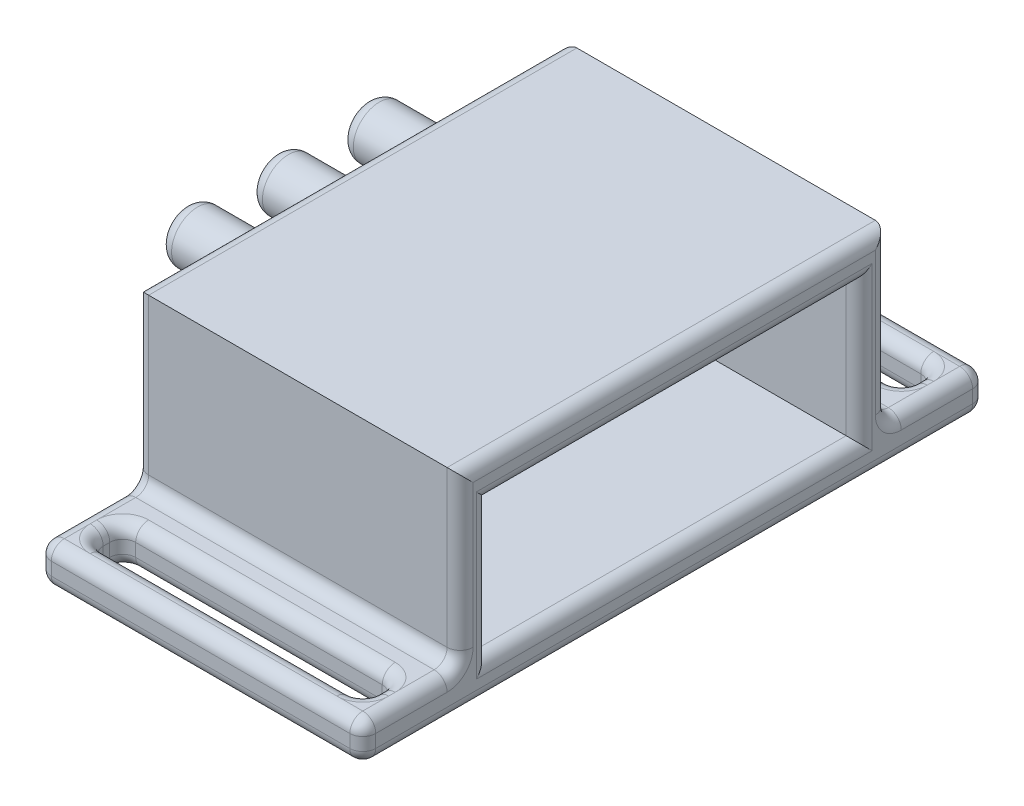
from build123d import *

# Parameters (mm, degrees)
BOSS_EXTRUDE1_DEPTH = 16
CUT_EXTRUDE1_DEPTH  = 12.5
SKETCH3_R           = 0.6000000000000006
SKETCH3_R_2         = 0.6000000000000004
CUT_EXTRUDE2_DEPTH  = 5.300000000000001
CUT_EXTRUDE3_DEPTH  = 13
FILLET1_R           = 1
SKETCH10_R          = 1.9999999999999996
SKETCH10_R_2        = 1.0000000000000033
SKETCH10_R_3        = 1.0000000000000018
SKETCH10_R_4        = 0.9999999999999979
BOSS_EXTRUDE2_DEPTH = 10
FILLET2_R           = 1
SKETCH11_W          = 21.000000000000004
SKETCH11_H          = 2.5
CUT_EXTRUDE5_DEPTH  = 56.65968020030299
FILLET3_R           = 1


with BuildPart() as part:
    # Sketch1 → Boss-Extrude1 (new body)
    with BuildSketch(Plane(origin=(0, 0, 0), x_dir=(1, 0, 0), z_dir=(0, 1, 0))):
        Polygon((0, 0), (25, 0), (25.000000000000007, -48), (5.88e-15, -48), align=None)
    extrude(amount=BOSS_EXTRUDE1_DEPTH)

    # Sketch2 → Cut-Extrude1 (cut)
    with BuildSketch(Plane(origin=(25, 0, -3.61e-15), x_dir=(0, 0, -1), z_dir=(1, 0, 0))):
        Polygon((-38.25000000000001, 13.245627447168781), (-38.25000000000001, 2.74562744716878), (-9.750000000000004, 2.74562744716878), (-9.750000000000005, 13.245627447168781), align=None)
    extrude(amount=-CUT_EXTRUDE1_DEPTH, mode=Mode.SUBTRACT)

    # Sketch3 → Cut-Extrude2 (cut)
    with BuildSketch(Plane(origin=(12.5, 0, 0), x_dir=(0, 0, -1), z_dir=(1, 0, 0))):
        with Locations((-32.699999999999996, 11.195627447168775)):
            Circle(SKETCH3_R)
        with Locations((-32.699999999999996, 4.7956274471687745)):
            Circle(SKETCH3_R_2)
    extrude(amount=-CUT_EXTRUDE2_DEPTH, mode=Mode.SUBTRACT)

    # Sketch4 → Cut-Extrude3 (cut)
    with BuildSketch(Plane(origin=(0, 16, 0), x_dir=(1, 0, 0), z_dir=(0, 1, 0))):
        Polygon((25.000000000000007, -48), (4.96e-15, -48), (0, -40.5), (25.000000000000007, -40.5), align=None)
        Polygon((4.96e-15, 0), (0, -7.5), (25.000000000000007, -7.5), (25.000000000000007, 0), align=None)
    extrude(amount=-CUT_EXTRUDE3_DEPTH, mode=Mode.SUBTRACT)

    # Fillet1
    fillet1_edges = [part.edges().sort_by_distance(p)[0] for p in [
        (12.500000000000004, 3, 40.5),
        (12.500000000000004, 3, 7.5),
    ]]
    fillet(fillet1_edges, radius=FILLET1_R)

    # Cut-Loft2: read off the stored shape, not the designer's step
    # Cut-Loft2: loft between two sections, ruled curve by curve
    cut_loft2_from = [
        Edge.make_bspline([(12.5, 6.795627447, 30.95), (12.5, 6.795627447, 31.2), (12.5, 6.795627447, 31.45), (12.5, 6.795627447, 31.95), (12.5, 6.795627447, 32.2), (12.5, 6.795627447, 32.45)], [0, 0, 0, 0, 0.5, 0.5, 1, 1, 1, 1], 3),
        Edge.make_bspline([(12.5, 6.795627447, 32.45), (12.5, 7.003960781, 32.45), (12.5, 7.212294114, 32.45), (12.5, 7.628960781, 32.45), (12.5, 7.837294114, 32.45), (12.5, 8.253960781, 32.45), (12.5, 8.462294114, 32.45), (12.5, 8.878960781, 32.45), (12.5, 9.087294114, 32.45), (12.5, 9.295627447, 32.45)], [0, 0, 0, 0, 0.250000000000001, 0.250000000000001, 0.5, 0.5, 0.750000000000001, 0.750000000000001, 1, 1, 1, 1], 3),
        Edge.make_bspline([(12.5, 9.295627447, 30.95), (12.5, 9.087294114, 30.95), (12.5, 8.878960781, 30.95), (12.5, 8.462294114, 30.95), (12.5, 8.253960781, 30.95), (12.5, 7.837294114, 30.95), (12.5, 7.628960781, 30.95), (12.5, 7.212294114, 30.95), (12.5, 7.003960781, 30.95), (12.5, 6.795627447, 30.95)], [0, 0, 0, 0, 0.25, 0.25, 0.5, 0.5, 0.75, 0.75, 1, 1, 1, 1], 3),
        Edge.make_bspline([(12.5, 9.295627447, 32.45), (12.5, 9.295627447, 32.2), (12.5, 9.295627447, 31.95), (12.5, 9.295627447, 31.45), (12.5, 9.295627447, 31.2), (12.5, 9.295627447, 30.95)], [0, 0, 0, 0, 0.5, 0.5, 1, 1, 1, 1], 3),
    ]
    cut_loft2_to = [
        Edge.make_bspline([(0, 7.142507074, 19.218529655), (0, 7.05427178, 19.365588479), (0, 7, 19.548369434), (0, 7, 19.917681387), (0, 7.05427178, 20.100462342), (0, 7.142507074, 20.247521166)], [0, 0, 0, 0, 0.5, 0.5, 1, 1, 1, 1], 3),
        Edge.make_bspline([(0, 7.142507074, 20.247521166), (0, 7.216036486, 20.370070186), (0, 7.327020284, 20.493043717), (0, 7.624617715, 20.676220865), (0, 7.811269874, 20.733025411), (0, 8.188730126, 20.733025411), (0, 8.375382285, 20.676220865), (0, 8.672979716, 20.493043717), (0, 8.783963514, 20.370070186), (0, 8.857492926, 20.247521166)], [0, 0, 0, 0, 0.250000000000001, 0.250000000000001, 0.5, 0.5, 0.750000000000001, 0.750000000000001, 1, 1, 1, 1], 3),
        Edge.make_bspline([(0, 8.857492926, 19.218529655), (0, 8.783963514, 19.095980635), (0, 8.672979716, 18.973007104), (0, 8.375382285, 18.789829956), (0, 8.188730126, 18.733025411), (0, 7.811269874, 18.733025411), (0, 7.624617715, 18.789829956), (0, 7.327020284, 18.973007104), (0, 7.216036486, 19.095980635), (0, 7.142507074, 19.218529655)], [0, 0, 0, 0, 0.25, 0.25, 0.5, 0.5, 0.75, 0.75, 1, 1, 1, 1], 3),
        Edge.make_bspline([(0, 8.857492926, 20.247521166), (0, 8.94572822, 20.100462342), (0, 9, 19.917681387), (0, 9, 19.548369434), (0, 8.94572822, 19.365588479), (0, 8.857492926, 19.218529655)], [0, 0, 0, 0, 0.5, 0.5, 1, 1, 1, 1], 3),
    ]
    cut_loft2 = Solid(Shell([*[Face.make_surface_from_curves(cut_loft2_from[k], cut_loft2_to[k]) for k in range(4)], Face(Wire(cut_loft2_from)), Face(Wire(cut_loft2_to))]))
    add(cut_loft2, mode=Mode.SUBTRACT)

    # Cut-Loft4: read off the stored shape, not the designer's step
    # Cut-Loft4: loft between two sections, ruled curve by curve
    cut_loft4_from = [
        Edge.make_bspline([(12.5, 9.295627447, 34.2), (12.5, 9.295627447, 34.075), (12.5, 9.295627447, 33.95), (12.5, 9.295627447, 33.7), (12.5, 9.295627447, 33.575), (12.5, 9.295627447, 33.45)], [0, 0, 0, 0, 0.5, 0.5, 1, 1, 1, 1], 3),
        Edge.make_bspline([(12.5, 9.295627447, 33.45), (12.5, 9.087294114, 33.45), (12.5, 8.878960781, 33.45), (12.5, 8.462294114, 33.45), (12.5, 8.253960781, 33.45), (12.5, 7.837294114, 33.45), (12.5, 7.628960781, 33.45), (12.5, 7.212294114, 33.45), (12.5, 7.003960781, 33.45), (12.5, 6.795627447, 33.45)], [0, 0, 0, 0, 0.249999999999999, 0.249999999999999, 0.5, 0.5, 0.749999999999999, 0.749999999999999, 1, 1, 1, 1], 3),
        Edge.make_bspline([(12.5, 8.695627447, 34.8), (12.5, 8.795627447, 34.7), (12.5, 8.895627447, 34.6), (12.5, 9.095627447, 34.4), (12.5, 9.195627447, 34.3), (12.5, 9.295627447, 34.2)], [0, 0, 0, 0, 0.5, 0.5, 1, 1, 1, 1], 3),
        Edge.make_bspline([(12.5, 6.795627447, 33.45), (12.5, 6.795627447, 33.675), (12.5, 6.795627447, 33.9), (12.5, 6.795627447, 34.35), (12.5, 6.795627447, 34.575), (12.5, 6.795627447, 34.8)], [0, 0, 0, 0, 0.5, 0.5, 1, 1, 1, 1], 3),
        Edge.make_bspline([(12.5, 6.795627447, 34.8), (12.5, 6.953960781, 34.8), (12.5, 7.112294114, 34.8), (12.5, 7.428960781, 34.8), (12.5, 7.587294114, 34.8), (12.5, 7.903960781, 34.8), (12.5, 8.062294114, 34.8), (12.5, 8.378960781, 34.8), (12.5, 8.537294114, 34.8), (12.5, 8.695627447, 34.8)], [0, 0, 0, 0, 0.249999999999999, 0.249999999999999, 0.5, 0.5, 0.749999999999999, 0.749999999999999, 1, 1, 1, 1], 3),
    ]
    cut_loft4_to = [
        Edge.make_bspline([(0, 8.998568132, 26.786520132), (0, 9.003886024, 26.687252823), (0, 8.994180904, 26.584862881), (0, 8.943981757, 26.38770491), (0, 8.903539704, 26.293141015), (0, 8.851397206, 26.208503917)], [0, 0, 0, 0, 0.5, 0.5, 1, 1, 1, 1], 3),
        Edge.make_bspline([(0, 8.851397206, 26.208503917), (0, 8.775012225, 26.0845167), (0, 8.659234178, 25.959756968), (0, 8.347529555, 25.778165737), (0, 8.151524507, 25.725335713), (0, 7.759998995, 25.742673089), (0, 7.56943076, 25.812621197), (0, 7.274996989, 26.021053205), (0, 7.170699601, 26.15555823), (0, 7.105572809, 26.285811815)], [0, 0, 0, 0, 0.249999999999999, 0.249999999999999, 0.5, 0.5, 0.749999999999999, 0.749999999999999, 1, 1, 1, 1], 3),
        Edge.make_bspline([(0, 8.618872227, 27.518517083), (0, 8.726826819, 27.433461949), (0, 8.821455862, 27.321156525), (0, 8.953912509, 27.065799909), (0, 8.991216048, 26.923759036), (0, 8.998568132, 26.786520132)], [0, 0, 0, 0, 0.5, 0.5, 1, 1, 1, 1], 3),
        Edge.make_bspline([(0, 7.105572809, 26.285811815), (0, 7.040078162, 26.416801108), (0, 7.001391776, 26.569965211), (0, 6.998685155, 26.878543774), (0, 7.034678913, 27.032362916), (0, 7.097865778, 27.164480908)], [0, 0, 0, 0, 0.5, 0.5, 1, 1, 1, 1], 3),
        Edge.make_bspline([(0, 7.097865778, 27.164480908), (0, 7.154014911, 27.28188364), (0, 7.239719, 27.400041431), (0, 7.471325712, 27.595255697), (0, 7.61727024, 27.67067187), (0, 7.929321587, 27.743306319), (0, 8.093568568, 27.740091691), (0, 8.387575769, 27.667221639), (0, 8.516649225, 27.599056418), (0, 8.618872227, 27.518517083)], [0, 0, 0, 0, 0.249999999999999, 0.249999999999999, 0.5, 0.5, 0.749999999999999, 0.749999999999999, 1, 1, 1, 1], 3),
    ]
    cut_loft4 = Solid(Shell([*[Face.make_surface_from_curves(cut_loft4_from[k], cut_loft4_to[k]) for k in range(5)], Face(Wire(cut_loft4_from)), Face(Wire(cut_loft4_to))]))
    add(cut_loft4, mode=Mode.SUBTRACT)

    # Cut-Loft5: read off the stored shape, not the designer's step
    # Cut-Loft5: loft between two sections, ruled curve by curve
    cut_loft5_from = [
        Edge.make_bspline([(12.5, 9.295627447, 29.95), (12.5, 9.295627447, 29.7), (12.5, 9.295627447, 29.45), (12.5, 9.295627447, 28.95), (12.5, 9.295627447, 28.7), (12.5, 9.295627447, 28.45)], [0, 0, 0, 0, 0.5, 0.5, 1, 1, 1, 1], 3),
        Edge.make_bspline([(12.5, 9.295627447, 28.45), (12.5, 9.087294114, 28.45), (12.5, 8.878960781, 28.45), (12.5, 8.462294114, 28.45), (12.5, 8.253960781, 28.45), (12.5, 7.837294114, 28.45), (12.5, 7.628960781, 28.45), (12.5, 7.212294114, 28.45), (12.5, 7.003960781, 28.45), (12.5, 6.795627447, 28.45)], [0, 0, 0, 0, 0.25, 0.25, 0.5, 0.5, 0.75, 0.75, 1, 1, 1, 1], 3),
        Edge.make_bspline([(12.5, 6.795627447, 29.95), (12.5, 7.003960781, 29.95), (12.5, 7.212294114, 29.95), (12.5, 7.628960781, 29.95), (12.5, 7.837294114, 29.95), (12.5, 8.253960781, 29.95), (12.5, 8.462294114, 29.95), (12.5, 8.878960781, 29.95), (12.5, 9.087294114, 29.95), (12.5, 9.295627447, 29.95)], [0, 0, 0, 0, 0.250000000000001, 0.250000000000001, 0.5, 0.5, 0.750000000000001, 0.750000000000001, 1, 1, 1, 1], 3),
        Edge.make_bspline([(12.5, 6.795627447, 28.45), (12.5, 6.795627447, 28.7), (12.5, 6.795627447, 28.95), (12.5, 6.795627447, 29.45), (12.5, 6.795627447, 29.7), (12.5, 6.795627447, 29.95)], [0, 0, 0, 0, 0.5, 0.5, 1, 1, 1, 1], 3),
    ]
    cut_loft5_to = [
        Edge.make_bspline([(0, 8.857492926, 13.247521166), (0, 8.94572822, 13.100462342), (0, 9, 12.917681387), (0, 9, 12.548369434), (0, 8.94572822, 12.365588479), (0, 8.857492926, 12.218529655)], [0, 0, 0, 0, 0.5, 0.5, 1, 1, 1, 1], 3),
        Edge.make_bspline([(0, 8.857492926, 12.218529655), (0, 8.783963514, 12.095980635), (0, 8.672979716, 11.973007104), (0, 8.375382285, 11.789829956), (0, 8.188730126, 11.733025411), (0, 7.811269874, 11.733025411), (0, 7.624617715, 11.789829956), (0, 7.327020284, 11.973007104), (0, 7.216036486, 12.095980635), (0, 7.142507074, 12.218529655)], [0, 0, 0, 0, 0.25, 0.25, 0.5, 0.5, 0.75, 0.75, 1, 1, 1, 1], 3),
        Edge.make_bspline([(0, 7.142507074, 13.247521166), (0, 7.216036486, 13.370070186), (0, 7.327020284, 13.493043717), (0, 7.624617715, 13.676220865), (0, 7.811269874, 13.733025411), (0, 8.188730126, 13.733025411), (0, 8.375382285, 13.676220865), (0, 8.672979716, 13.493043717), (0, 8.783963514, 13.370070186), (0, 8.857492926, 13.247521166)], [0, 0, 0, 0, 0.250000000000001, 0.250000000000001, 0.5, 0.5, 0.750000000000001, 0.750000000000001, 1, 1, 1, 1], 3),
        Edge.make_bspline([(0, 7.142507074, 12.218529655), (0, 7.05427178, 12.365588479), (0, 7, 12.548369434), (0, 7, 12.917681387), (0, 7.05427178, 13.100462342), (0, 7.142507074, 13.247521166)], [0, 0, 0, 0, 0.5, 0.5, 1, 1, 1, 1], 3),
    ]
    cut_loft5 = Solid(Shell([*[Face.make_surface_from_curves(cut_loft5_from[k], cut_loft5_to[k]) for k in range(4)], Face(Wire(cut_loft5_from)), Face(Wire(cut_loft5_to))]))
    add(cut_loft5, mode=Mode.SUBTRACT)

    # Sketch10 → Boss-Extrude2 (add)
    # profile 1 of 3: a face of its own
    with BuildSketch(Plane.ZY):
        with Locations(Location((12.733025410502131, 8, 0), (0, 0, 180))):
            Circle(SKETCH10_R)
        with Locations(Location((12.733025410502131, 8, 0), (0, 0, 120.963749699))):
            Circle(SKETCH10_R_2, mode=Mode.SUBTRACT)
    # profile 2 of 3: a face of its own
    with BuildSketch(Plane.ZY):
        with Locations(Location((19.73302541050213, 8, 0), (0, 0, 180))):
            Circle(SKETCH10_R)
        with Locations(Location((19.73302541050213, 8, 0), (0, 0, 239.036243468))):
            Circle(SKETCH10_R_3, mode=Mode.SUBTRACT)
    # profile 3 of 3: a face of its own
    with BuildSketch(Plane.ZY):
        with Locations(Location((26.73302541050213, 8, 0), (0, 0, 180))):
            Circle(SKETCH10_R)
        with Locations(Location((26.73302541050213, 8, 0), (0, 0, 121.636035999))):
            Circle(SKETCH10_R_4, mode=Mode.SUBTRACT)
    extrude(amount=BOSS_EXTRUDE2_DEPTH)

    # Fillet2
    fillet2_edges = [part.edges().sort_by_distance(p)[0] for p in [
        (1.8e-15, 7.999999999999999, 14.733025410502131),
        (-9.999999999999998, 7.999999999999999, 14.733025410502133),
        (2.66e-15, 7.999999999999999, 21.73302541050213),
        (-9.999999999999998, 7.999999999999999, 21.73302541050213),
        (3.52e-15, 7.999999999999999, 28.73302541050213),
        (-9.999999999999996, 7.999999999999999, 28.73302541050213),
    ]]
    fillet(fillet2_edges, radius=FILLET2_R - 0.0001)  # a hair under: the kernel refuses the full size

    # Sketch11 → Cut-Extrude5 (cut, through all)
    with BuildSketch(Plane(origin=(0, 3.000000000000001, 0), x_dir=(1, 0, 0), z_dir=(0, 1, 0))):
        with Locations((12.500000000000005, -3.25)):
            Rectangle(SKETCH11_W, SKETCH11_H)
        with Locations((12.500000000000005, -44.75)):
            Rectangle(SKETCH11_W, SKETCH11_H)
    extrude(amount=-CUT_EXTRUDE5_DEPTH, mode=Mode.SUBTRACT)

    # Fillet3
    fillet3_edges = [part.edges().sort_by_distance(p)[0] for p in [
        (25, 13.245627447168781, 24.000000000000004),
        (25, 7.995627447168781, 38.25),
        (25, 2.74562744716878, 24.000000000000004),
        (25, 7.99562744716878, 9.75),
        (2.0000000000000053, 0, 3.25),
        (2.000000000000005, 1.5000000000000004, 4.5),
        (12.500000000000007, 0, 2),
        (2.000000000000005, 1.5000000000000004, 2),
        (23.000000000000007, 0, 3.25),
        (23.000000000000007, 1.5000000000000004, 2),
        (12.500000000000005, 0, 4.5),
        (23.000000000000007, 1.5000000000000004, 4.5),
        (2.000000000000005, 3.000000000000001, 3.25),
        (12.500000000000005, 3.000000000000001, 4.5),
        (23.000000000000007, 3.000000000000001, 3.25),
        (12.500000000000007, 3.000000000000001, 2),
        (12.500000000000007, 0, 43.5),
        (2.000000000000005, 1.5000000000000004, 43.5),
        (23.000000000000007, 0, 44.75),
        (23.000000000000007, 1.5000000000000004, 43.5),
        (12.500000000000005, 0, 46),
        (23.000000000000007, 1.5000000000000004, 46),
        (2.0000000000000053, 0, 44.75),
        (2.000000000000005, 1.5000000000000004, 46),
        (12.500000000000007, 3.000000000000001, 43.5),
        (2.000000000000005, 3.000000000000001, 44.75),
        (12.500000000000005, 3.000000000000001, 46),
        (23.000000000000007, 3.000000000000001, 44.75),
        (25.000000000000004, 16, 24),
        (25.000000000000007, 1.5, 48),
        (5.88e-15, 1.5, 48),
        (25.000000000000007, 3, 44.75),
        (12.500000000000005, 3, 48),
        (12.5, 0, 0),
        (25.000000000000004, 0, 24),
        (2.94e-15, 16, 24),
        (0, 1.5, 0),
        (25, 1.5, 0),
        (12.500000000000007, 0, 48),
        (12.500000000000005, 3, 0),
        (2.81e-15, 3, 3.25),
        (2.94e-15, 0, 24),
        (25.000000000000007, 3, 3.25),
        (25.000000000000007, 10, 7.5),
        (0, 10, 7.5),
        (2.81e-15, 3, 44.75),
        (0, 10, 40.5),
        (25.000000000000007, 10, 40.5),
        (25, 3.292893218813452, 7.207106781186547),
        (8e-16, 3.292893218813452, 7.207106781186547),
        (5.08e-15, 3.2928932188134525, 40.792893218813454),
        (25.000000000000007, 3.2928932188134525, 40.792893218813454),
    ]]
    fillet(fillet3_edges, radius=FILLET3_R - 0.0001)  # a hair under: the kernel refuses the full size


solid = part.part
